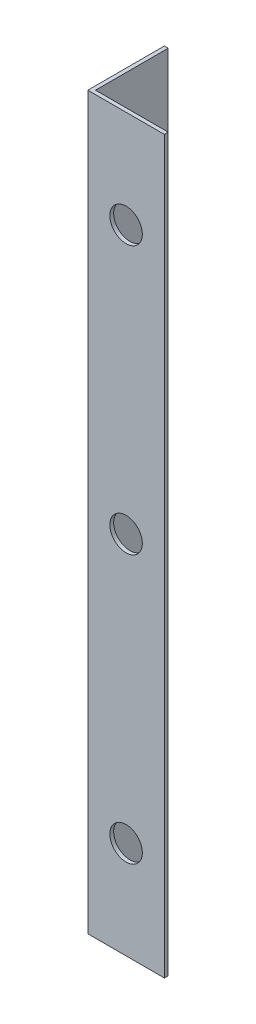
from build123d import *

# Parameters (mm, degrees)
EXTRUDE_1_DEPTH     = 191
SKETCH_2_R          = 4.25
CUT_EXTRUDE_1_DEPTH = 194.082883757


with BuildPart() as part:
    # Эскиз1 → Бобышка-Вытянуть1 (new body)
    with BuildSketch(Plane(origin=(0, 0, 0), x_dir=(1, 0, 0), z_dir=(0, 1, 0))):
        Polygon((0, 0), (0, 20), (1, 20), (1, 1), (20, 1), (20, 0), align=None)
    extrude(amount=EXTRUDE_1_DEPTH)

    # Эскиз2 → Вырез-Вытянуть1 (cut, through all)
    with BuildSketch(Plane.XY):
        with Locations((10, 165.5)):
            Circle(SKETCH_2_R)
        with Locations((10, 95.5)):
            Circle(SKETCH_2_R)
        with Locations((10, 25.5)):
            Circle(SKETCH_2_R)
    extrude(amount=-CUT_EXTRUDE_1_DEPTH, mode=Mode.SUBTRACT)


solid = part.part
